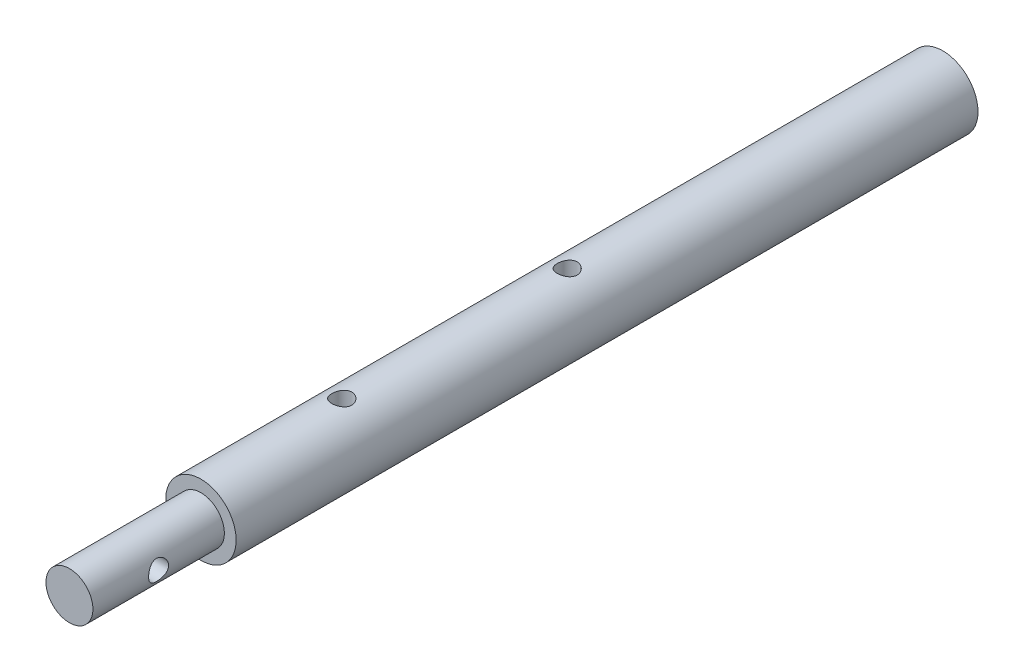
from build123d import *

# Parameters (mm, degrees)
SKETCH1_R             = 4.7625
BOSS_EXTRUDE1_DEPTH   = 100.33
SKETCH2_R             = 3.175
BOSS_EXTRUDE2_DEPTH   = 17.78
F_6_32_TAPPED_HOLE1_D = 2.7051
F_6_32_TAPPED_HOLE2_D = 2.7051


with BuildPart() as part:
    # Sketch1 → Boss-Extrude1 (new body)
    with BuildSketch(Plane.XY):
        Circle(SKETCH1_R)
    extrude(amount=BOSS_EXTRUDE1_DEPTH)

    # Sketch2 → Boss-Extrude2 (add)
    with BuildSketch(Plane.XY.offset(100.33)):
        Circle(SKETCH2_R)
    extrude(amount=BOSS_EXTRUDE2_DEPTH)

    # #6-32 Tapped Hole1 (through all)
    with Locations(Plane(origin=(0, 4.7625, 0), x_dir=(1, 0, 0), z_dir=(0, 1, 0))):
        with Locations((0, -50.8), (0, -81.28)):
            Hole(F_6_32_TAPPED_HOLE1_D / 2)

    # #6-32 Tapped Hole2 (through all)
    with Locations(Plane(origin=(3.175, 0, 0), x_dir=(0, 0, -1), z_dir=(1, 0, 0))):
        with Locations((-109.22, 0)):
            Hole(F_6_32_TAPPED_HOLE2_D / 2)


solid = part.part
